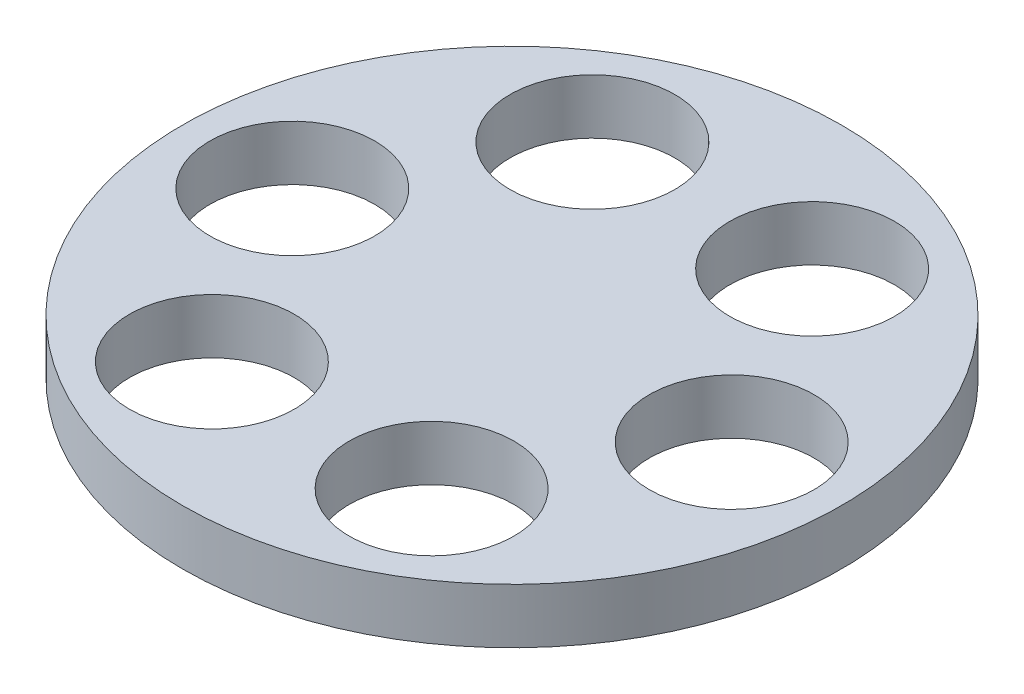
from build123d import *

# Parameters (mm, degrees)
ESQUISSE1_R                      = 60
BOSS_EXTRU_1_DEPTH               = 5
ESQUISSE2_R                      = 15
ENL_V_MAT_EXTRU_1_DEPTH          = 86
R_P_TITION_START                 = -5
R_P_TITION_CIRCULAIRE1_OUTLINE_R = 15
R_P_TITION_CIRCULAIRE1_DEPTH     = 10


# Read off the part's stored shape, not the designer's step: Répétition circulaire1
with BuildPart() as part:
    # Esquisse1 → Boss.-Extru.1 (new, symmetric)
    with BuildSketch(Plane(origin=(0, 0, 0), x_dir=(1, 0, 0), z_dir=(0, 1, 0))):
        with Locations(Location((0, 0, 0), (0, 0, 270))):
            Circle(ESQUISSE1_R)
    extrude(amount=BOSS_EXTRU_1_DEPTH, both=True)

    # Esquisse2 → Enlèv. mat.-Extru.1 (cut, symmetric)
    with BuildSketch(Plane(origin=(0, 0, 0), x_dir=(1, 0, 0), z_dir=(0, 1, 0))):
        with Locations(Location((40, 0, 0), (0, 0, 270))):
            Circle(ESQUISSE2_R)
    extrude(amount=ENL_V_MAT_EXTRU_1_DEPTH, both=True, mode=Mode.SUBTRACT)

    # Répétition circulaire1 outline → Répétition circulaire1 (cut)
    with BuildSketch(Plane(origin=(0, 0, 0), x_dir=(1, 0, 0), z_dir=(0, 1, 0)).offset(R_P_TITION_START)):
        with Locations((20, 34.641016151)):
            Circle(R_P_TITION_CIRCULAIRE1_OUTLINE_R)
        with Locations((-20, 34.641016151)):
            Circle(R_P_TITION_CIRCULAIRE1_OUTLINE_R)
        with Locations((-40, 0)):
            Circle(R_P_TITION_CIRCULAIRE1_OUTLINE_R)
        with Locations((-20, -34.641016151)):
            Circle(R_P_TITION_CIRCULAIRE1_OUTLINE_R)
        with Locations((20, -34.641016151)):
            Circle(R_P_TITION_CIRCULAIRE1_OUTLINE_R)
    extrude(amount=R_P_TITION_CIRCULAIRE1_DEPTH, mode=Mode.SUBTRACT)


solid = part.part
